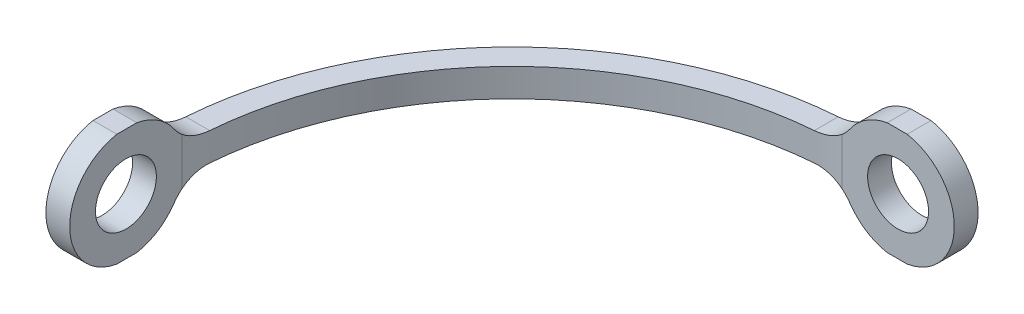
from build123d import *

# Parameters (mm, degrees)
SKETCH1_W             = 7.5
SKETCH1_H             = 1.5875
BOSS_EXTRUDE1_DEPTH   = 3.75
SKETCH1_W_2           = 1.5875
SKETCH1_H_2           = 7.5
BOSS_EXTRUDE1_2_DEPTH = 3.75
BOSS_EXTRUDE2_DEPTH   = 0.9375
SKETCH2_R             = 2.032
CUT_EXTRUDE1_DEPTH    = 41.393705032
SKETCH3_R             = 2.032
CUT_EXTRUDE2_DEPTH    = 41.393705032
FILLET5_R             = 2.8125


with BuildPart() as part:
    # Sketch1 → Boss-Extrude1 (new, symmetric)
    with BuildSketch(Plane(origin=(0, 0, 0), x_dir=(1, 0, 0), z_dir=(0, 1, 0))):
        with Locations((0, 26.54375)):
            Rectangle(SKETCH1_W, SKETCH1_H)
    extrude(amount=BOSS_EXTRUDE1_DEPTH, both=True)



with BuildPart() as body_2:
    # Sketch1 → Boss-Extrude1 2 (new, symmetric)
    with BuildSketch(Plane(origin=(0, 0, 0), x_dir=(1, 0, 0), z_dir=(0, 1, 0))):
        with Locations((-26.54375, 0)):
            Rectangle(SKETCH1_W_2, SKETCH1_H_2)
    extrude(amount=BOSS_EXTRUDE1_2_DEPTH, both=True)


with BuildPart() as part_1:
    add(part.part)

    add(body_2.part)  # Boss-Extrude2 merges body 2
    # Sketch1<3> → Boss-Extrude2 (add, symmetric)
    with BuildSketch(Plane(origin=(0, 0, 0), x_dir=(1, 0, 0), z_dir=(0, 1, 0))):
        with BuildLine():
            ThreePointArc((-25.75, 3.75), (-19.306349186, 19.306349186), (-3.75, 25.75))
            Line((-3.75, 25.75), (-3.75, 27.3375))
            ThreePointArc((-3.75, 27.3375), (-20.428881201, 20.428881201), (-27.3375, 3.75))
            Line((-27.3375, 3.75), (-25.75, 3.75))
        make_face()
    extrude(amount=BOSS_EXTRUDE2_DEPTH, both=True)

    # Sketch2 → Cut-Extrude1 (cut, through all)
    with BuildSketch(Plane.XY.offset(-25.75)):
        Circle(SKETCH2_R)
        with BuildLine():
            Line((-3.75, 3.75), (-3.75, 0.9375))
            ThreePointArc((-3.75, 0.9375), (-2.651505376, 2.789658698), (-0.724090822, 3.75))
            Line((-0.724090822, 3.75), (-3.75, 3.75))
        make_face()
        with BuildLine():
            ThreePointArc((-0.724090822, -3.75), (-2.651505376, -2.789658698), (-3.75, -0.9375))
            Line((-3.75, -0.9375), (-3.75, -3.75))
            Line((-3.75, -3.75), (-0.724090822, -3.75))
        make_face()
        with BuildLine():
            Line((3.75, 3.75), (0.606903322, 3.75))
            ThreePointArc((0.606903322, 3.75), (2.860309669, 2.446505504), (3.75, 0))
            Line((3.75, 0), (3.75, 3.75))
        make_face()
        with BuildLine():
            ThreePointArc((3.75, 0), (2.860309669, -2.446505504), (0.606903322, -3.75))
            Line((0.606903322, -3.75), (3.75, -3.75))
            Line((3.75, -3.75), (3.75, 0))
        make_face()
    extrude(amount=-CUT_EXTRUDE1_DEPTH, mode=Mode.SUBTRACT)

    # Sketch3 → Cut-Extrude2 (cut, through all)
    with BuildSketch(Plane(origin=(-25.75, 0, 0), x_dir=(0, 0, -1), z_dir=(1, 0, 0))):
        Circle(SKETCH3_R)
        with BuildLine():
            ThreePointArc((0.724090822, 3.75), (2.651505376, 2.789658698), (3.75, 0.9375))
            Line((3.75, 0.9375), (3.75, 3.75))
            Line((3.75, 3.75), (0.724090822, 3.75))
        make_face()
        with BuildLine():
            Line((3.75, -3.75), (3.75, -0.9375))
            ThreePointArc((3.75, -0.9375), (2.651505376, -2.789658698), (0.724090822, -3.75))
            Line((0.724090822, -3.75), (3.75, -3.75))
        make_face()
        with BuildLine():
            ThreePointArc((-3.75, 0), (-2.860309669, 2.446505504), (-0.606903322, 3.75))
            Line((-0.606903322, 3.75), (-3.75, 3.75))
            Line((-3.75, 3.75), (-3.75, 0))
        make_face()
        with BuildLine():
            Line((-3.75, -3.75), (-0.606903322, -3.75))
            ThreePointArc((-0.606903322, -3.75), (-2.860309669, -2.446505504), (-3.75, 0))
            Line((-3.75, 0), (-3.75, -3.75))
        make_face()
    extrude(amount=-CUT_EXTRUDE2_DEPTH, mode=Mode.SUBTRACT)

    # Fillet5
    fillet5_edges = [part_1.edges().sort_by_distance(p)[0] for p in [
        (-3.75, 0.9375, -26.54375),
    ]]
    fillet(fillet5_edges, radius=FILLET5_R)
    fillet5_2_edges = [part_1.edges().sort_by_distance(p)[0] for p in [
        (-3.75, -0.9375, -26.54375),
    ]]
    fillet(fillet5_2_edges, radius=FILLET5_R)
    fillet5_3_edges = [part_1.edges().sort_by_distance(p)[0] for p in [
        (-26.54375, 0.9375, -3.75),
    ]]
    fillet(fillet5_3_edges, radius=FILLET5_R)
    fillet5_4_edges = [part_1.edges().sort_by_distance(p)[0] for p in [
        (-26.54375, -0.9375, -3.75),
    ]]
    fillet(fillet5_4_edges, radius=FILLET5_R)


solid = part_1.part
